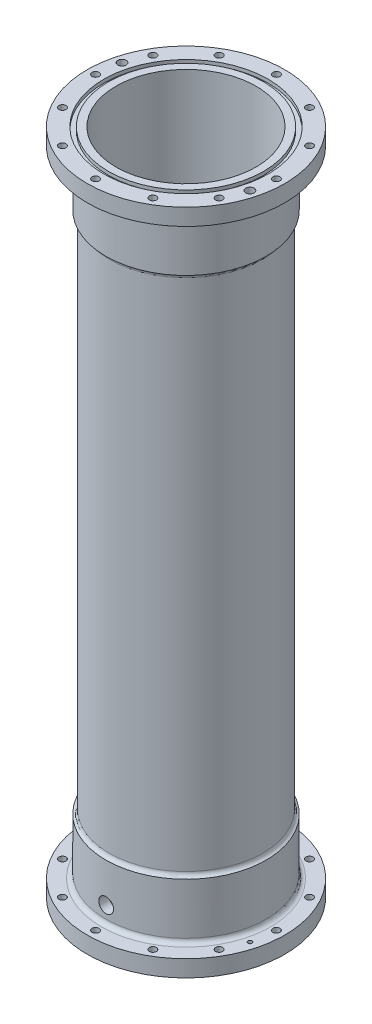
from build123d import *

# Parameters (mm, degrees)
SKETCH2_R               = 43.815
SKETCH2_R_2             = 40
BASE_CYLINDER_DEPTH     = 381
SKETCH3_R               = 56.35625
SKETCH3_R_2             = 40
AFT_FLANGE_DEPTH        = 9.525
SKETCH6_R               = 46.9011
SKETCH6_R_2             = 44.2849
AFT_O_RING_DEPTH        = 1.9812
SKETCH33_R              = 45.72
SKETCH33_R_2            = 43.815
CRITICALBOSS_DEPTH      = 31.75
FILLET1_R               = 2.54
BOLT_CIRCLE_D           = 4.0386
HOLE1_D                 = 2.38125
HOLE1_CBORE_D           = 4.7625
HOLE1_CBORE_DEPTH       = 4.7625
F_3_8_24_TAPPED_HOLE1_D = 8.4328
FILLET1_OF_MIRROR1_R    = 2.54


with BuildPart() as part:
    # Sketch2 → Base Cylinder (new body)
    with BuildSketch(Plane(origin=(0, 0, 0), x_dir=(1, 0, 0), z_dir=(0, 1, 0))):
        with Locations(Location((0, 0, 0), (0, 0, 270))):
            Circle(SKETCH2_R)
        with Locations(Location((0, 0, 0), (0, 0, 270))):
            Circle(SKETCH2_R_2, mode=Mode.SUBTRACT)
    extrude(amount=BASE_CYLINDER_DEPTH)

    # Sketch3 → Aft Flange (add)
    with BuildSketch(Plane.XZ):
        with Locations(Location((0, 0, 0), (0, 0, 270))):
            Circle(SKETCH3_R)
        with Locations(Location((0, 0, 0), (0, 0, 90))):
            Circle(SKETCH3_R_2, mode=Mode.SUBTRACT)
    aft_flange = extrude(amount=-AFT_FLANGE_DEPTH)

    # Sketch6 → Aft O-Ring (cut)
    with BuildSketch(Plane.XZ):
        with Locations(Location((0, 0, 0), (0, 0, 270))):
            Circle(SKETCH6_R)
        with Locations(Location((0, 0, 0), (0, 0, 270))):
            Circle(SKETCH6_R_2, mode=Mode.SUBTRACT)
    aft_o_ring = extrude(amount=-AFT_O_RING_DEPTH, mode=Mode.SUBTRACT)

    # Sketch33 → CriticalBoss (add)
    with BuildSketch(Plane(origin=(0, 9.525, 0), x_dir=(1, 0, 0), z_dir=(0, 1, 0))):
        with Locations(Location((0, 0, 0), (0, 0, 90))):
            Circle(SKETCH33_R)
        with Locations(Location((0, 0, 0), (0, 0, 270))):
            Circle(SKETCH33_R_2, mode=Mode.SUBTRACT)
    criticalboss = extrude(amount=CRITICALBOSS_DEPTH)

    # Fillet1
    # the kernel refuses this fillet: 2.54 mm, written as the material it adds along each edge
    with BuildSketch(Plane(origin=(0, 9.525, 0), x_dir=(0, 0, -1), z_dir=(1, 0, 0))) as fillet1_piece_1:
        with BuildLine():
            CenterArc((45.72 + FILLET1_R, FILLET1_R), FILLET1_R, 180, 90)
            Line((45.72, FILLET1_R), (45.72 - FILLET1_R * 0.02, FILLET1_R))
            Line((45.72 - FILLET1_R * 0.02, FILLET1_R), (45.72 - FILLET1_R * 0.02, -FILLET1_R * 0.02))
            Line((45.72 - FILLET1_R * 0.02, -FILLET1_R * 0.02), (45.72 + FILLET1_R, -FILLET1_R * 0.02))
            Line((45.72 + FILLET1_R, -FILLET1_R * 0.02), (45.72 + FILLET1_R, 0))
        make_face()
    revolve(axis=Axis((0, 9.525, 0), (0, 1, 0)))
    with BuildSketch(Plane(origin=(0, 41.275, 0), x_dir=(0, 0, 1), z_dir=(-1, 0, 0))) as fillet1_piece_2:
        with BuildLine():
            CenterArc((46.355, 2.459344425), FILLET1_R, 180, 75.522487814)
            Line((43.815, 2.459344425), (43.7642, 2.459344425))
            Line((43.7642, 2.459344425), (43.7642, 0))
            Line((43.7642, 0), (43.815, -0.0508))
            ThreePointArc((43.815, -0.0508), (44.7675, -0.0508), (45.7073, -0.049186888))
            Line((45.7073, -0.049186888), (45.72, 0))
        make_face()
    revolve(axis=Axis((0, 41.275, 0), (0, 1, 0)))

    # Bolt Circle (through all)
    with Locations(Plane(origin=(0, 0, 0), x_dir=(-1, 0, 0), z_dir=(0, -1, 0))):
        with Locations((-25.81275, -44.708994483), (-44.708994483, -25.81275), (-51.6255, 0), (-44.708994483, 25.81275), (-25.81275, 44.708994483), (0, 51.6255), (25.81275, 44.708994483), (44.708994483, 25.81275), (51.6255, 0), (44.708994483, -25.81275), (25.81275, -44.708994483), (0, -51.6255)):
            bolt_circle = Hole(BOLT_CIRCLE_D / 2)

    # Hole1 (through all)
    with Locations(Plane(origin=(0, 0, 0), x_dir=(-1, 0, 0), z_dir=(0, -1, 0))):
        with Locations((49.866403745, 13.361662613), (-49.866403745, -13.361662613)):
            hole1 = CounterBoreHole(HOLE1_D / 2, HOLE1_CBORE_D / 2, HOLE1_CBORE_DEPTH)

    # Sketch44 → 1/8 NPT Tapped ThermocoupleHole (revolve, cut)
    with BuildSketch(Plane(origin=(0, 19.05, -45.72), x_dir=(0, 1, 0), z_dir=(1, 0, 0))):
        Polygon((0, 0), (0, 14.213468714), (4.2164, 11.68), (4.2164, 6.86), (4.537404713, 6.86), (4.7428023, 0), align=None)
    revolve(axis=Axis((0, 19.05, -52.07), (0, 0, 1)), mode=Mode.SUBTRACT)

    # 3/8-24 Tapped Hole1 (through all)
    with Locations(Plane.XY.offset(45.72)):
        with Locations((0, 19.05)):
            Hole(F_3_8_24_TAPPED_HOLE1_D / 2)

    # Mirror1: Aft Flange, Aft O-Ring, CriticalBoss, Bolt Circle, Hole1 across plane
    add(aft_flange.mirror(Plane.ZX.offset(190.5)))
    add(aft_o_ring.mirror(Plane.ZX.offset(190.5)), mode=Mode.SUBTRACT)
    add(criticalboss.mirror(Plane.ZX.offset(190.5)))
    add(bolt_circle.mirror(Plane.ZX.offset(190.5)), mode=Mode.SUBTRACT)
    add(hole1.mirror(Plane.ZX.offset(190.5)), mode=Mode.SUBTRACT)

    # Fillet1 of Mirror1
    # the kernel refuses this fillet: 2.54 mm, written as the material it adds along each edge
    with BuildSketch(Plane(origin=(0, 371.475, 0), x_dir=(0, 0, -1), z_dir=(1, 0, 0))) as fillet1_of_mirror1_piece_1:
        with BuildLine():
            CenterArc((45.72 + FILLET1_OF_MIRROR1_R, -FILLET1_OF_MIRROR1_R), FILLET1_OF_MIRROR1_R, 90, 90)
            Line((45.72 + FILLET1_OF_MIRROR1_R, 0), (45.72 + FILLET1_OF_MIRROR1_R, FILLET1_OF_MIRROR1_R * 0.02))
            Line((45.72 + FILLET1_OF_MIRROR1_R, FILLET1_OF_MIRROR1_R * 0.02), (45.72 - FILLET1_OF_MIRROR1_R * 0.02, FILLET1_OF_MIRROR1_R * 0.02))
            Line((45.72 - FILLET1_OF_MIRROR1_R * 0.02, FILLET1_OF_MIRROR1_R * 0.02), (45.72 - FILLET1_OF_MIRROR1_R * 0.02, -FILLET1_OF_MIRROR1_R))
            Line((45.72 - FILLET1_OF_MIRROR1_R * 0.02, -FILLET1_OF_MIRROR1_R), (45.72, -FILLET1_OF_MIRROR1_R))
        make_face()
    revolve(axis=Axis((0, 371.475, 0), (0, 1, 0)))
    with BuildSketch(Plane(origin=(0, 339.725, 0), x_dir=(0, 0, 1), z_dir=(-1, 0, 0))) as fillet1_of_mirror1_piece_2:
        with BuildLine():
            CenterArc((46.355, -2.459344425), FILLET1_OF_MIRROR1_R, 104.477512186, 75.522487814)
            Line((45.72, 0), (45.7073, 0.049186888))
            ThreePointArc((45.7073, 0.049186888), (44.7675, 0.0508), (43.815, 0.0508))
            Line((43.815, 0.0508), (43.7642, 0))
            Line((43.7642, 0), (43.7642, -2.459344425))
            Line((43.7642, -2.459344425), (43.815, -2.459344425))
        make_face()
    revolve(axis=Axis((0, 339.725, 0), (0, 1, 0)))


solid = part.part
